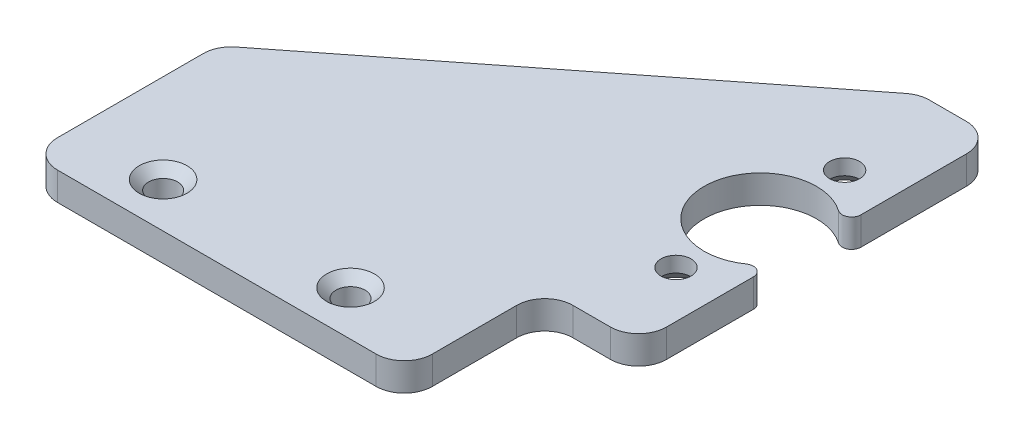
from build123d import *

# Parameters (mm, degrees)
ESBO_O1_R                 = 1.6
RESSALTO_EXTRUS_O10_DEPTH = 3
FILETE2_R                 = 1
CHANFRO1_SIZE             = 1.35
ESBO_O5_W                 = 50
ESBO_O5_H                 = 13
RESSALTO_EXTRUS_O13_DEPTH = 3
ESBO_O7_R                 = 1.55
CORTE_EXTRUS_O1_DEPTH     = 42.509035161
ESBO_O8_W                 = 10
ESBO_O8_H                 = 15
CORTE_EXTRUS_O2_DEPTH     = 42.509035161
FILETE3_R                 = 3
CHANFRO2_SIZE             = 1
ESBO_O9_R                 = 4
RESSALTO_EXTRUS_O14_DEPTH = 8


with BuildPart() as part:
    # Esboço1 → Ressalto-extrusão10 (new body)
    with BuildSketch(Plane(origin=(0, 0, 0), x_dir=(1, 0, 0), z_dir=(0, 1, 0))):
        with BuildLine():
            Line((25, 20), (-25, 20))
            Line((-25, 20), (-25, -20))
            Line((-25, -20), (25, -20))
            Line((25, -20), (25, -3.31662479))
            ThreePointArc((25, -3.31662479), (14, 0), (25, 3.31662479))
            Line((25, 3.31662479), (25, 20))
        make_face()
        with Locations((20, -9)):
            Circle(ESBO_O1_R, mode=Mode.SUBTRACT)
        with Locations((20, 9)):
            Circle(ESBO_O1_R, mode=Mode.SUBTRACT)
    extrude(amount=RESSALTO_EXTRUS_O10_DEPTH)

    # Filete2
    filete2_edges = [part.edges().sort_by_distance(p)[0] for p in [
        (25, 1.5, -3.31662479),
        (25, 1.5, 3.31662479),
    ]]
    fillet(filete2_edges, radius=FILETE2_R)

    # Chanfro1
    chanfro1_edges = [part.edges().sort_by_distance(p)[0] for p in [
        (18.4, 0, -9),
        (18.4, 0, 9),
    ]]
    chamfer(chanfro1_edges, length=CHANFRO1_SIZE)

    # Esboço5 → Ressalto-extrusão13 (add)
    with BuildSketch(Plane.XZ):
        with Locations((0, 26.5)):
            Rectangle(ESBO_O5_W, ESBO_O5_H)
    extrude(amount=-RESSALTO_EXTRUS_O13_DEPTH)

    # Esboço7 → Corte-extrusão1 (cut, through all)
    with BuildSketch(Plane.XZ):
        with Locations((-15.5, 28.234562647)):
            Circle(ESBO_O7_R)
        with Locations((4.5, 28.234562647)):
            Circle(ESBO_O7_R)
    extrude(amount=-CORTE_EXTRUS_O1_DEPTH, mode=Mode.SUBTRACT)

    # Esboço8 → Corte-extrusão2 (cut, through all)
    with BuildSketch(Plane.XZ):
        Polygon((-25, -20), (-25, 13), (17, -20), align=None)
        with Locations((20, 25.5)):
            Rectangle(ESBO_O8_W, ESBO_O8_H)
    extrude(amount=-CORTE_EXTRUS_O2_DEPTH, mode=Mode.SUBTRACT)

    # Filete3
    filete3_edges = [part.edges().sort_by_distance(p)[0] for p in [
        (15, 1.5, 18),
        (-25, 1.5, 13),
        (-25, 1.5, 33),
        (15, 1.5, 33),
        (25, 1.5, 18),
        (25, 1.5, -20),
        (17, 1.5, -20),
    ]]
    fillet(filete3_edges, radius=FILETE3_R)

    # Chanfro2
    chanfro2_edges = [part.edges().sort_by_distance(p)[0] for p in [
        (2.95, 3, 28.234562647),
        (-17.05, 3, 28.234562647),
    ]]
    chamfer(chanfro2_edges, length=CHANFRO2_SIZE)

    # Esboço9 → Ressalto-extrusão14 (add)
    with BuildSketch(Plane.XZ):
        with Locations((-5.5, 10.234562647)):
            Circle(ESBO_O9_R)
    extrude(amount=RESSALTO_EXTRUS_O14_DEPTH)


solid = part.part
